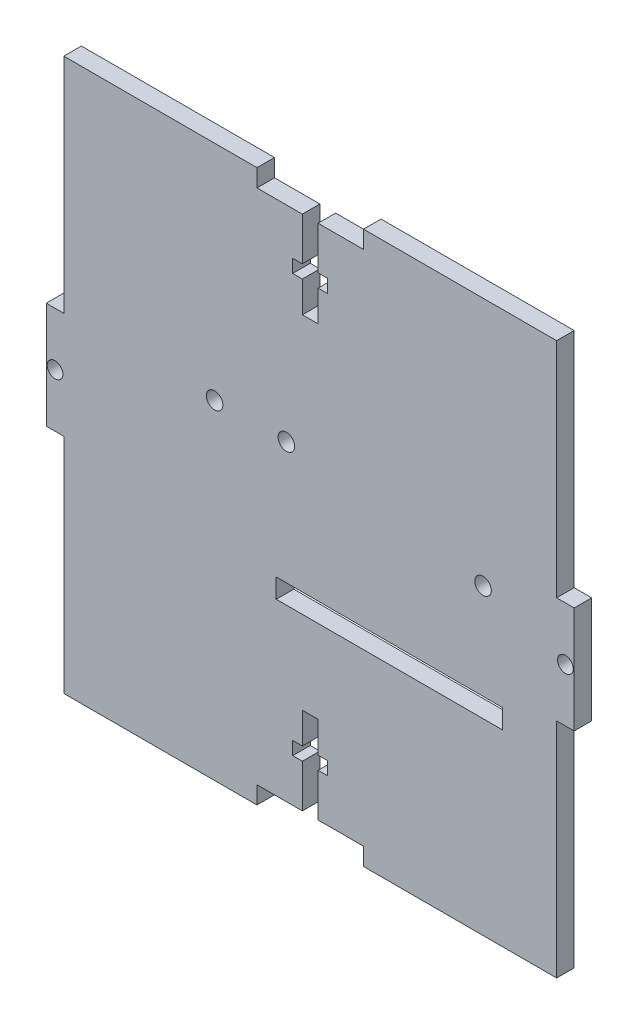
from build123d import *

# Parameters (mm, degrees)
BOSS_EXTRUDE1_DEPTH = 3.18
SKETCH18_W          = 3.18
SKETCH18_H          = 19.3
BOSS_EXTRUDE8_DEPTH = 3.18
SKETCH19_R          = 1.425
CUT_EXTRUDE8_DEPTH  = 70.262854583
CUT_EXTRUDE13_DEPTH = 70.262854583
SKETCH31_R          = 1.5
SKETCH31_W          = 41
SKETCH31_H          = 3.5
CUT_EXTRUDE16_DEPTH = 70.262854583


with BuildPart() as part:
    # Sketch1 → Boss-Extrude1 (new body)
    with BuildSketch(Plane.XY):
        Polygon((-44.645, 50), (-14.881666667, 50), (14.881666667, 50), (44.645, 50), (44.645, -50), (-44.645, -50), align=None)
    extrude(amount=BOSS_EXTRUDE1_DEPTH)

    # Sketch18 → Boss-Extrude8 (add)
    with BuildSketch(Plane(origin=(44.645, 0, 0), x_dir=(0, 0, -1), z_dir=(1, 0, 0))):
        with Locations((-1.59, 0)):
            Rectangle(SKETCH18_W, SKETCH18_H)
    boss_extrude8 = extrude(amount=BOSS_EXTRUDE8_DEPTH)

    # Sketch19 → Cut-Extrude8 (cut, through all)
    with BuildSketch(Plane.XY.offset(3.18)):
        with Locations((46.235, 0)):
            Circle(SKETCH19_R)
    cut_extrude8 = extrude(amount=-CUT_EXTRUDE8_DEPTH, mode=Mode.SUBTRACT)

    # Mirror2: Boss-Extrude8, Cut-Extrude8 across plane
    add(boss_extrude8.mirror(Plane(origin=(0, 0, 0), x_dir=(0, 0, 1), z_dir=(1, 0, 0))))
    add(cut_extrude8.mirror(Plane(origin=(0, 0, 0), x_dir=(0, 0, 1), z_dir=(1, 0, 0))), mode=Mode.SUBTRACT)

    # Sketch26 → Cut-Extrude13 (cut, through all)
    with BuildSketch(Plane.XY.offset(3.18)):
        Polygon((-9.65, 50), (9.65, 50), (9.65, 46.82), (1.425, 46.82), (1.425, 39.02), (3.175, 39.02), (3.175, 36.64), (1.425, 36.64), (1.425, 31.02), (-1.425, 31.02), (-1.425, 36.64), (-3.175, 36.64), (-3.175, 39.02), (-1.425, 39.02), (-1.425, 46.82), (-9.65, 46.82), align=None)
    cut_extrude13 = extrude(amount=-CUT_EXTRUDE13_DEPTH, mode=Mode.SUBTRACT)

    # Mirror7: Cut-Extrude13 across plane
    add(cut_extrude13.mirror(Plane.ZX), mode=Mode.SUBTRACT)

    # Sketch31 → Cut-Extrude16 (cut, through all)
    with BuildSketch(Plane.XY.offset(3.18)):
        with Locations((-17.325, 9.65)):
            Circle(SKETCH31_R)
        with Locations((31.306146823, 4.864159796)):
            Circle(SKETCH31_R)
        with Locations((-4.325, 9.65)):
            Circle(SKETCH31_R)
        with Locations((14.3410024, -14.225840204)):
            Rectangle(SKETCH31_W, SKETCH31_H)
    extrude(amount=-CUT_EXTRUDE16_DEPTH, mode=Mode.SUBTRACT)


solid = part.part
